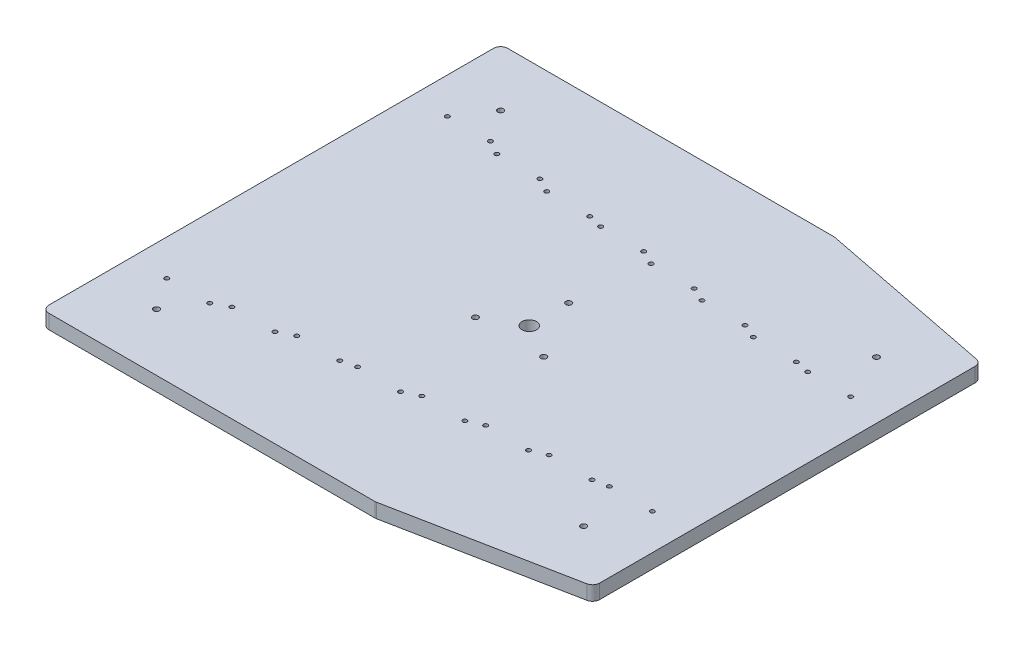
from build123d import *

# Parameters (mm, degrees)
SKETCH1_W              = 457.2
SKETCH1_H              = 406.4
BOSS_EXTRUDE1_DEPTH    = 12.7
F_6_CLEARANCE_HOLE1_D  = 3.7973
SKETCH5_R              = 6.4135
CUT_EXTRUDE2_DEPTH     = 307.120058147
CUT_EXTRUDE3_DEPTH     = 3.175
F_10_CLEARANCE_HOLE1_D = 5.1054
CUT_EXTRUDE4_DEPTH     = 307.120058147
FILLET1_R              = 6.35
F_10_CLEARANCE_HOLE2_D = 5.1054
SKETCH18_R             = 6.985
CUT_EXTRUDE6_DEPTH     = 4.7625


with BuildPart() as part:
    # Sketch1 → Boss-Extrude1 (new body)
    with BuildSketch(Plane(origin=(0, 0, 0), x_dir=(1, 0, 0), z_dir=(0, 1, 0))):
        Rectangle(SKETCH1_W, SKETCH1_H)
    extrude(amount=BOSS_EXTRUDE1_DEPTH)

    # #6 Clearance Hole1 (through all)
    with Locations(Plane(origin=(0, 0, 0), x_dir=(-1, 0, 0), z_dir=(0, -1, 0))):
        with Locations((-196.85, 87.87638), (-158.75, 87.87638), (-146.05, 90.45448), (-107.95, 90.45448), (-95.25, 95.83166), (-57.15, 95.83166), (-44.45, 101.50348), (-6.35, 101.50348), (6.35, 107.61726), (44.45, 107.61726), (57.15, 110.71098), (95.25, 110.71098), (107.95, 117.34038), (146.05, 117.34038), (158.75, 124.26442), (196.85, 124.26442), (196.85, -124.26442), (158.75, -124.26442), (146.05, -117.34038), (107.95, -117.34038), (95.25, -110.71098), (57.15, -110.71098), (44.45, -107.61726), (6.35, -107.61726), (-6.35, -101.50348), (-44.45, -101.50348), (-57.15, -95.83166), (-95.25, -95.83166), (-107.95, -90.45448), (-146.05, -90.45448), (-158.75, -87.87638), (-196.85, -87.87638)):
            Hole(F_6_CLEARANCE_HOLE1_D / 2)

    # Sketch5 → Cut-Extrude2 (cut, through all)
    with BuildSketch(Plane.XZ):
        Circle(SKETCH5_R)
    extrude(amount=-CUT_EXTRUDE2_DEPTH, mode=Mode.SUBTRACT)

    # Sketch6 → Cut-Extrude3 (cut)
    with BuildSketch(Plane.XZ):
        Polygon((-192.913, -121.99139199), (-196.85, -119.71836398), (-200.787, -121.99139199), (-200.787, -126.53744801), (-196.85, -128.81047602), (-192.913, -126.53744801), align=None)
    cut_extrude3 = extrude(amount=-CUT_EXTRUDE3_DEPTH, mode=Mode.SUBTRACT)

    # Sketch-Pattern1: Cut-Extrude3 at 31 more places
    with Locations((393.7, 0, 36.38804), (355.6, 0, 36.38804), (342.9, 0, 33.80994), (304.8, 0, 33.80994), (292.1, 0, 28.43276), (254, 0, 28.43276), (241.3, 0, 22.76094), (203.2, 0, 22.76094), (190.5, 0, 16.64716), (152.4, 0, 16.64716), (139.7, 0, 13.55344), (101.6, 0, 13.55344), (88.9, 0, 6.92404), (50.8, 0, 6.92404), (38.1, 0, 0), (0, 0, 248.52884), (38.1, 0, 248.52884), (50.8, 0, 241.6048), (88.9, 0, 241.6048), (101.6, 0, 234.9754), (139.7, 0, 234.9754), (152.4, 0, 231.88168), (190.5, 0, 231.88168), (203.2, 0, 225.7679), (241.3, 0, 225.7679), (254, 0, 220.09608), (292.1, 0, 220.09608), (304.8, 0, 214.7189), (342.9, 0, 214.7189), (355.6, 0, 212.1408), (393.7, 0, 212.1408)):
        add(cut_extrude3, mode=Mode.SUBTRACT)

    # #10 Clearance Hole1 (through all)
    with Locations(Plane(origin=(0, 12.7, 0), x_dir=(1, 0, 0), z_dir=(0, 1, 0))):
        with Locations((-30.245937227, -17.4625), (0, 34.925), (30.245937227, -17.4625)):
            Hole(F_10_CLEARANCE_HOLE1_D / 2)

    # Sketch10 → Cut-Extrude4 (cut, through all)
    with BuildSketch(Plane(origin=(0, 12.7, 0), x_dir=(1, 0, 0), z_dir=(0, 1, 0))):
        Polygon((67.035234154, -203.2), (228.6, -171.45), (228.6, -203.2), align=None)
        Polygon((228.6, 203.2), (67.035234154, 203.2), (228.6, 171.45), align=None)
    extrude(amount=-CUT_EXTRUDE4_DEPTH, mode=Mode.SUBTRACT)

    # Fillet1
    fillet1_edges = [part.edges().sort_by_distance(p)[0] for p in [
        (-228.6, 6.35, 203.2),
        (-228.6, 6.35, -203.2),
        (228.6, 6.35, -171.45),
        (228.6, 6.35, 171.45),
        (67.035234154, 6.35, -203.2),
        (67.035234154, 6.35, 203.2),
    ]]
    fillet(fillet1_edges, radius=FILLET1_R)

    # #10 Clearance Hole2 (through all)
    with Locations(Plane(origin=(0, 12.7, 0), x_dir=(1, 0, 0), z_dir=(0, 1, 0))):
        with Locations((177.8, -129.661378082), (-177.8, -152.4), (-177.8, 152.4), (177.8, 129.661378082)):
            Hole(F_10_CLEARANCE_HOLE2_D / 2)

    # Sketch18 → Cut-Extrude6 (cut)
    with BuildSketch(Plane.XZ):
        with Locations((-196.85, -124.26442)):
            Circle(SKETCH18_R)
    cut_extrude6 = extrude(amount=-CUT_EXTRUDE6_DEPTH, mode=Mode.SUBTRACT)

    # Sketch-Pattern2: Cut-Extrude6 at 31 more places
    with Locations((393.7, 0, 36.38804), (355.6, 0, 36.38804), (342.9, 0, 33.80994), (304.8, 0, 33.80994), (292.1, 0, 28.43276), (254, 0, 28.43276), (241.3, 0, 22.76094), (203.2, 0, 22.76094), (190.5, 0, 16.64716), (152.4, 0, 16.64716), (139.7, 0, 13.55344), (101.6, 0, 13.55344), (88.9, 0, 6.92404), (50.8, 0, 6.92404), (38.1, 0, 0), (0, 0, 248.52884), (38.1, 0, 248.52884), (50.8, 0, 241.6048), (88.9, 0, 241.6048), (101.6, 0, 234.9754), (139.7, 0, 234.9754), (152.4, 0, 231.88168), (190.5, 0, 231.88168), (203.2, 0, 225.7679), (241.3, 0, 225.7679), (254, 0, 220.09608), (292.1, 0, 220.09608), (304.8, 0, 214.7189), (342.9, 0, 214.7189), (355.6, 0, 212.1408), (393.7, 0, 212.1408)):
        add(cut_extrude6, mode=Mode.SUBTRACT)


solid = part.part
